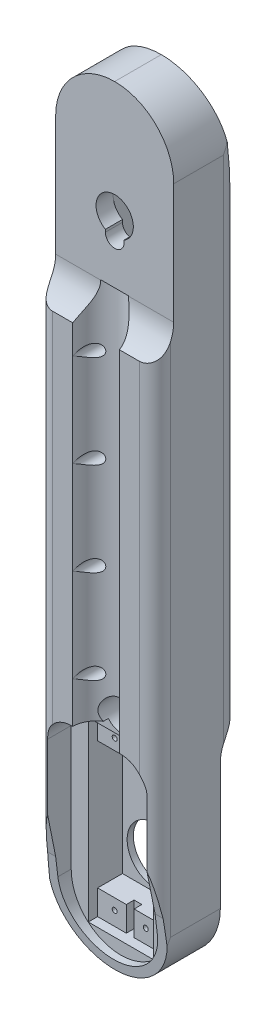
from build123d import *

# Parameters (mm, degrees)
SKETCH1_W                 = 38
SKETCH1_H                 = 227.5
SKETCH1_W_2               = 21
SKETCH1_H_2               = 41
BOSS_EXTRUDE1_DEPTH       = 11
SKETCH3_R                 = 0.8
CUT_EXTRUDE1_DEPTH        = 8
FILLET3_R                 = 19
BOSS_EXTRUDE2_DEPTH       = 8
CUT_EXTRUDE2_DEPTH        = 117.880547997
CUT_EXTRUDE2_DEPTH_BACK   = 117.880547997
SKETCH7_W                 = 32
SKETCH7_H                 = 157.5
BOSS_EXTRUDE4_DEPTH       = 8
SKETCH8_W                 = 38
SKETCH8_H                 = 157.5
BOSS_EXTRUDE5_DEPTH       = 8
BOSS_EXTRUDE10_START      = 2
SKETCH27_R                = 9
BOSS_EXTRUDE10_DEPTH      = 2
SKETCH28_W                = 38
SKETCH28_H                = 27
BOSS_EXTRUDE11_DEPTH      = 20
FILLET4_R                 = 19
CUT_EXTRUDE14_DEPTH       = 8
SKETCH30_W                = 12
SKETCH30_H                = 23
CUT_EXTRUDE15_DEPTH       = 7.5
CUT_EXTRUDE25_DEPTH       = 136.979088466
CUT_EXTRUDE17_START       = 65.75
CUT_EXTRUDE17_OUTLINE_W   = 38
CUT_EXTRUDE17_OUTLINE_H   = 6
CUT_EXTRUDE17_DEPTH       = 68
FILLET5_R                 = 12
CUT_EXTRUDE18_DEPTH       = 141.335535414
FILLET7_R                 = 5
SKETCH34_R                = 0.8
CUT_EXTRUDE19_DEPTH       = 8
SKETCH35_R                = 0.8
CUT_EXTRUDE20_DEPTH       = 8
FILLET8_R                 = 8
SKETCH36_W                = 12
SKETCH36_H                = 32
CUT_EXTRUDE21_DEPTH       = 2.8
SKETCH40_R                = 7.5
CUT_EXTRUDE28_DEPTH       = 123
SKETCH41_R                = 7.5
CUT_EXTRUDE29_DEPTH       = 121
CUT_EXTRUDE30_START       = -27.0000001
CUT_EXTRUDE30_OUTLINE_R   = 2
CUT_EXTRUDE30_OUTLINE_R_2 = 5
CUT_EXTRUDE30_DEPTH       = 27.0000001
SKETCH43_W                = 21
SKETCH43_H                = 57
CUT_EXTRUDE31_DEPTH       = 3
SKETCH44_W                = 2.5
SKETCH44_H                = 8
CUT_EXTRUDE32_DEPTH       = 2.5


# Read off the part's stored shape, not the designer's step: Cut-Extrude17, Cut-Extrude30
# Some blends are built 0.0001 mm under size
with BuildPart() as part:
    # Sketch1 → Boss-Extrude1 (new body)
    with BuildSketch(Plane.XY):
        Rectangle(SKETCH1_W, SKETCH1_H)
        with Locations((0, -78.25)):
            Rectangle(SKETCH1_W_2, SKETCH1_H_2, mode=Mode.SUBTRACT)
    extrude(amount=BOSS_EXTRUDE1_DEPTH)

    # Sketch3 → Cut-Extrude1 (cut)
    with BuildSketch(Plane.XY.offset(10)):
        with Locations((-5, -54.25)):
            Circle(SKETCH3_R)
        with Locations((5, -54.25)):
            Circle(SKETCH3_R)
        with Locations((5, -102.25)):
            Circle(SKETCH3_R)
        with Locations((-5, -102.25)):
            Circle(SKETCH3_R)
    extrude(amount=-CUT_EXTRUDE1_DEPTH, mode=Mode.SUBTRACT)

    # Fillet3
    fillet3_edges = [part.edges().sort_by_distance(p)[0] for p in [
        (19, -113.75, 5.5),
        (-19, -113.75, 5.5),
    ]]
    fillet(fillet3_edges, radius=FILLET3_R - 0.0001)  # a hair under: the kernel refuses the full size

    # Sketch4 → Boss-Extrude2 (add)
    with BuildSketch(Plane.XY.offset(11)):
        with BuildLine():
            Line((19, -94.75), (19, 113.75))
            Line((19, 113.75), (-19, 113.75))
            Line((-19, 113.75), (-19, -94.75))
            ThreePointArc((-19, -94.75), (-13.435028843, -108.185028843), (0, -113.75))
            ThreePointArc((0, -113.75), (13.435028843, -108.185028843), (19, -94.75))
        make_face()
        with BuildLine():
            Line((16, -94.75), (16, 110.75))
            Line((16, 110.75), (-16, 110.75))
            Line((-16, 110.75), (-16, -94.75))
            ThreePointArc((-16, -94.75), (-11.313708499, -106.063708499), (0, -110.75))
            ThreePointArc((0, -110.75), (11.313708499, -106.063708499), (16, -94.75))
        make_face(mode=Mode.SUBTRACT)
    extrude(amount=BOSS_EXTRUDE2_DEPTH)

    # Sketch6 → Cut-Extrude2 (cut, two sides: drawn at the far end of the back side and taken through both)
    with BuildSketch(Plane(origin=(0, 0, 0), x_dir=(0, 0, -1), z_dir=(1, 0, 0)).offset(-CUT_EXTRUDE2_DEPTH_BACK)):
        Polygon((-13, -113.75), (-16, -88.75), (-19, -73.75), (-19, -113.75), align=None)
    extrude(amount=CUT_EXTRUDE2_DEPTH + CUT_EXTRUDE2_DEPTH_BACK, mode=Mode.SUBTRACT)

    # Sketch7 → Boss-Extrude4 (add)
    with BuildSketch(Plane.XY.offset(11)):
        with Locations((0, 32)):
            Rectangle(SKETCH7_W, SKETCH7_H)
    extrude(amount=BOSS_EXTRUDE4_DEPTH)

    # Sketch8 → Boss-Extrude5 (add)
    with BuildSketch(Plane(origin=(0, 0, 0), x_dir=(-1, 0, 0), z_dir=(0, 0, -1))):
        with Locations((0, 35)):
            Rectangle(SKETCH8_W, SKETCH8_H)
    extrude(amount=BOSS_EXTRUDE5_DEPTH)

    # Sketch27 → Boss-Extrude10 (add)
    with BuildSketch(Plane(origin=(0, 0, 0), x_dir=(-1, 0, 0), z_dir=(0, 0, -1)).offset(BOSS_EXTRUDE10_START)):
        with BuildLine():
            Line((19, -94.75), (19, -43.75))
            Line((19, -43.75), (-19, -43.75))
            Line((-19, -43.75), (-19, -94.75))
            ThreePointArc((-19, -94.75), (-13.435028843, -108.185028843), (0, -113.75))
            ThreePointArc((0, -113.75), (13.435028843, -108.185028843), (19, -94.75))
        make_face()
        with Locations((0, -88.5)):
            Circle(SKETCH27_R, mode=Mode.SUBTRACT)
    extrude(amount=-BOSS_EXTRUDE10_DEPTH)

    # Sketch28 → Boss-Extrude11 (add)
    with BuildSketch(Plane(origin=(0, 113.75, 0), x_dir=(1, 0, 0), z_dir=(0, 1, 0))):
        with Locations((0, -5.5)):
            Rectangle(SKETCH28_W, SKETCH28_H)
    extrude(amount=BOSS_EXTRUDE11_DEPTH)

    # Fillet4
    fillet4_edges = [part.edges().sort_by_distance(p)[0] for p in [
        (-19, 133.75, 5.5),
        (19, 133.75, 5.5),
    ]]
    fillet(fillet4_edges, radius=FILLET4_R - 0.0001)  # a hair under: the kernel refuses the full size

    # Sketch29 → Cut-Extrude14 (cut)
    with BuildSketch(Plane(origin=(0, 0, -8), x_dir=(-1, 0, 0), z_dir=(0, 0, -1))):
        with BuildLine():
            Line((16, 66.75), (16, 114.75))
            ThreePointArc((16, 114.75), (11.313708499, 126.063708499), (0, 130.75))
            ThreePointArc((0, 130.75), (-11.313708499, 126.063708499), (-16, 114.75))
            Line((-16, 114.75), (-16, 66.75))
            Line((-16, 66.75), (16, 66.75))
        make_face()
    extrude(amount=-CUT_EXTRUDE14_DEPTH, mode=Mode.SUBTRACT)

    # Sketch30 → Cut-Extrude15 (cut)
    with BuildSketch(Plane(origin=(0, 0, 0), x_dir=(-1, 0, 0), z_dir=(0, 0, -1))):
        with Locations((0, 90.75)):
            Rectangle(SKETCH30_W, SKETCH30_H)
    extrude(amount=-CUT_EXTRUDE15_DEPTH, mode=Mode.SUBTRACT)

    # Sketch31 → Cut-Extrude25 (cut, through all)
    with BuildSketch(Plane(origin=(0, 0, 7.5), x_dir=(-1, 0, 0), z_dir=(0, 0, -1))):
        with BuildLine():
            Line((-3, 90.25), (-3, 91.053847577))
            ThreePointArc((-3, 91.053847577), (0, 102.25), (3, 91.053847577))
            Line((3, 91.053847577), (3, 90.25))
            ThreePointArc((3, 90.25), (0, 87.25), (-3, 90.25))
        make_face()
    extrude(amount=-CUT_EXTRUDE25_DEPTH, mode=Mode.SUBTRACT)

    # Cut-Extrude17 outline → Cut-Extrude17 (cut)
    with BuildSketch(Plane(origin=(0, 0, 0), x_dir=(1, 0, 0), z_dir=(0, 1, 0)).offset(CUT_EXTRUDE17_START)):
        with Locations((0, -16)):
            Rectangle(CUT_EXTRUDE17_OUTLINE_W, CUT_EXTRUDE17_OUTLINE_H)
    extrude(amount=CUT_EXTRUDE17_DEPTH, mode=Mode.SUBTRACT)

    # Fillet5
    # the kernel refuses this fillet: 12 mm, written as the material it adds along each edge
    with BuildSketch(Plane(origin=(-19, -43.75, -2), x_dir=(0, 0, -1), z_dir=(1, 0, 0))) as fillet5_piece_1:
        with BuildLine():
            CenterArc((12, -10.392304845), FILLET5_R, 120, 60)
            Line((0, -10.392304845), (-0.24, -10.392304845))
            Line((-0.24, -10.392304845), (-0.24, 0))
            Line((-0.24, 0), (0, 0.24))
            ThreePointArc((0, 0.24), (3, 0.24), (5.88, 0.207846097))
            Line((5.88, 0.207846097), (6, 0))
        make_face()
    extrude(amount=38)
    with BuildSketch(Plane(origin=(19, 65.75, 13), x_dir=(0, 0, 1), z_dir=(-1, 0, 0))) as fillet5_piece_2:
        with BuildLine():
            CenterArc((12, 10.392304845), FILLET5_R, 180, 60)
            Line((0, 10.392304845), (-0.24, 10.392304845))
            Line((-0.24, 10.392304845), (-0.24, 0))
            Line((-0.24, 0), (0, -0.24))
            ThreePointArc((0, -0.24), (3, -0.24), (5.88, -0.207846097))
            Line((5.88, -0.207846097), (6, 0))
        make_face()
    extrude(amount=38)

    # Sketch33 → Cut-Extrude18 (cut, through all)
    with BuildSketch(Plane(origin=(19, 0, 0), x_dir=(0, 0, -1), z_dir=(1, 0, 0))):
        Polygon((2, 133.75), (8, 93.75), (8, 133.75), align=None)
    extrude(amount=-CUT_EXTRUDE18_DEPTH, mode=Mode.SUBTRACT)

    # Fillet7
    # the kernel refuses this fillet: 5 mm, written as the material it takes off along each edge
    with BuildSketch(Plane(origin=(-19, 123.75, -8), x_dir=(0, 0, 1), z_dir=(0, -1, 0)), Plane(origin=(19, -73.75, -8), x_dir=(0, 0, 1), z_dir=(0, 1, 0))) as fillet7_piece_1:
        with BuildLine():
            CenterArc((FILLET7_R, -FILLET7_R), FILLET7_R, 90, 90)
            Line((0, -FILLET7_R), (-FILLET7_R * 0.02, -FILLET7_R))
            Line((-FILLET7_R * 0.02, -FILLET7_R), (-FILLET7_R * 0.02, FILLET7_R * 0.02))
            Line((-FILLET7_R * 0.02, FILLET7_R * 0.02), (FILLET7_R, FILLET7_R * 0.02))
            Line((FILLET7_R, FILLET7_R * 0.02), (FILLET7_R, 0))
        make_face()
    extrude(amount=197.5, mode=Mode.SUBTRACT)
    with BuildSketch(Plane(origin=(-19, -103.75, 19), x_dir=(1, 0, 0), z_dir=(0, 1, 0)), Plane(origin=(19, 95.75, 19), x_dir=(-1, 0, 0), z_dir=(0, -1, 0))) as fillet7_piece_2:
        with BuildLine():
            CenterArc((FILLET7_R, FILLET7_R), FILLET7_R, 180, 90)
            Line((0, FILLET7_R), (-FILLET7_R * 0.02, FILLET7_R))
            Line((-FILLET7_R * 0.02, FILLET7_R), (-FILLET7_R * 0.02, -FILLET7_R * 0.02))
            Line((-FILLET7_R * 0.02, -FILLET7_R * 0.02), (FILLET7_R, -FILLET7_R * 0.02))
            Line((FILLET7_R, -FILLET7_R * 0.02), (FILLET7_R, 0))
        make_face()
    extrude(amount=199.5, mode=Mode.SUBTRACT)

    # Sketch34 → Cut-Extrude19 (cut)
    with BuildSketch(Plane(origin=(0, 0, 0), x_dir=(-1, 0, 0), z_dir=(0, 0, -1))):
        with Locations((0, 104.5)):
            Circle(SKETCH34_R)
        with Locations((0, 77)):
            Circle(SKETCH34_R)
    extrude(amount=-CUT_EXTRUDE19_DEPTH, mode=Mode.SUBTRACT)

    # Sketch35 → Cut-Extrude20 (cut)
    with BuildSketch(Plane.XY.offset(11)):
        with Locations((-5, -54.25)):
            Circle(SKETCH35_R)
        with Locations((5, -54.25)):
            Circle(SKETCH35_R)
        with Locations((5, -102.25)):
            Circle(SKETCH35_R)
        with Locations((-5, -102.25)):
            Circle(SKETCH35_R)
    extrude(amount=-CUT_EXTRUDE20_DEPTH, mode=Mode.SUBTRACT)

    # Fillet8
    fillet8_edges = [part.edges().sort_by_distance(p)[0] for p in [
        (-16, -46.75, 14.791287847),
        (16, -46.75, 14.791287847),
        (16, 66.75, -3.791287847),
        (-16, 66.75, -3.791287847),
    ]]
    fillet(fillet8_edges, radius=FILLET8_R)

    # Sketch36 → Cut-Extrude21 (cut)
    with BuildSketch(Plane(origin=(0, 0, 0), x_dir=(-1, 0, 0), z_dir=(0, 0, -1))):
        with Locations((0, 90.75)):
            Rectangle(SKETCH36_W, SKETCH36_H)
    extrude(amount=-CUT_EXTRUDE21_DEPTH, mode=Mode.SUBTRACT)

    # Sketch40 → Cut-Extrude28 (cut)
    with BuildSketch(Plane.XZ.offset(46.75)):
        with Locations((0, 19)):
            Circle(SKETCH40_R)
    extrude(amount=-CUT_EXTRUDE28_DEPTH, mode=Mode.SUBTRACT)

    # Sketch41 → Cut-Extrude29 (cut)
    with BuildSketch(Plane(origin=(0, 66.75, 0), x_dir=(1, 0, 0), z_dir=(0, 1, 0))):
        with Locations((0, 8)):
            Circle(SKETCH41_R)
    extrude(amount=-CUT_EXTRUDE29_DEPTH, mode=Mode.SUBTRACT)

    # Cut-Extrude30 outline → Cut-Extrude30 (cut)
    with BuildSketch(Plane(origin=(0, 0, -8), x_dir=(-1, 0, 0), z_dir=(0, 0, -1)).offset(CUT_EXTRUDE30_START)):
        with Locations((-5.5, 56.5)):
            Circle(CUT_EXTRUDE30_OUTLINE_R)
        with Locations((5.5, -3.5)):
            Circle(CUT_EXTRUDE30_OUTLINE_R)
        with Locations((-5.5, -33.5)):
            Circle(CUT_EXTRUDE30_OUTLINE_R)
        with Locations((5.5, -33.5)):
            Circle(CUT_EXTRUDE30_OUTLINE_R)
        with Locations((0, -43.75)):
            Circle(CUT_EXTRUDE30_OUTLINE_R_2)
        with Locations((5.5, 56.5)):
            Circle(CUT_EXTRUDE30_OUTLINE_R)
        with Locations((-5.5, 26.5)):
            Circle(CUT_EXTRUDE30_OUTLINE_R)
        with Locations((5.5, 26.5)):
            Circle(CUT_EXTRUDE30_OUTLINE_R)
        with Locations((-5.5, -3.5)):
            Circle(CUT_EXTRUDE30_OUTLINE_R)
    extrude(amount=CUT_EXTRUDE30_DEPTH, mode=Mode.SUBTRACT)

    # Sketch43 → Cut-Extrude31 (cut)
    with BuildSketch(Plane.XY.offset(11)):
        with Locations((0, -78.25)):
            Rectangle(SKETCH43_W, SKETCH43_H)
    extrude(amount=-CUT_EXTRUDE31_DEPTH, mode=Mode.SUBTRACT)

    # Sketch44 → Cut-Extrude32 (cut)
    with BuildSketch(Plane.XY.offset(8)):
        with Locations((0, -53.75)):
            Rectangle(SKETCH44_W, SKETCH44_H)
        with Locations((0, -102.75)):
            Rectangle(SKETCH44_W, SKETCH44_H)
    extrude(amount=-CUT_EXTRUDE32_DEPTH, mode=Mode.SUBTRACT)


solid = part.part
